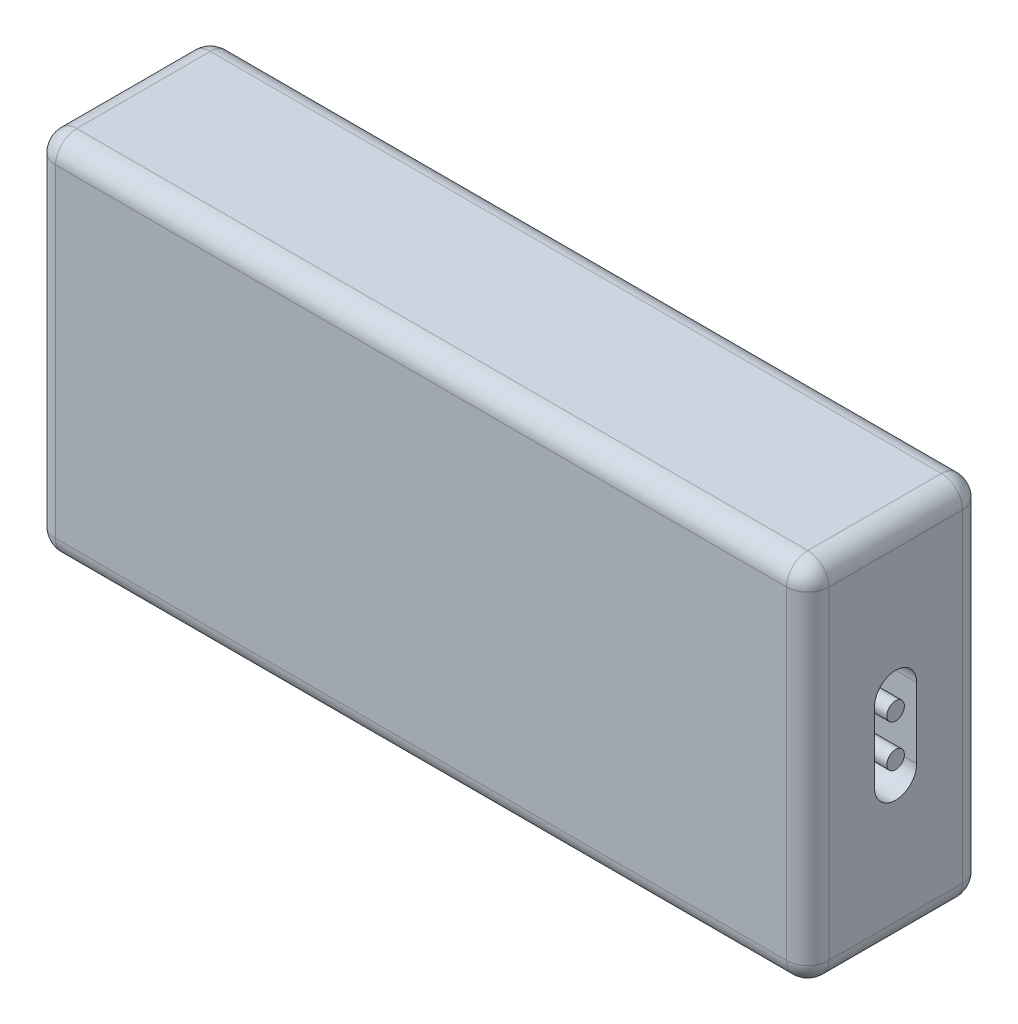
from build123d import *

# Parameters (mm, degrees)
SKETCH_1_W          = 110
SKETCH_1_H          = 52
EXTRUDE_1_DEPTH     = 25
SKETCH_2_R          = 1.25
CUT_EXTRUDE_1_DEPTH = 6
SKETCH_3_W          = 4
SKETCH_3_H          = 10
CUT_EXTRUDE_2_DEPTH = 6
SKETCH_4_W          = 4
SKETCH_4_H          = 10
CUT_EXTRUDE_3_DEPTH = 6
SKETCH_5_W          = 17
SKETCH_5_H          = 8
CUT_EXTRUDE_4_DEPTH = 2
FILLET_1_R          = 3


with BuildPart() as part:
    # Эскиз1 → Бобышка-Вытянуть1 (new body)
    with BuildSketch(Plane.XY):
        with Locations((55, 26)):
            Rectangle(SKETCH_1_W, SKETCH_1_H)
    extrude(amount=EXTRUDE_1_DEPTH)

    # Эскиз2 → Вырез-Вытянуть1 (cut)
    with BuildSketch(Plane(origin=(110, 0, 0), x_dir=(0, 0, -1), z_dir=(1, 0, 0))):
        with BuildLine():
            Line((-9.5, 31), (-9.5, 21))
            ThreePointArc((-9.5, 21), (-12.5, 18), (-15.5, 21))
            Line((-15.5, 21), (-15.5, 31))
            ThreePointArc((-15.5, 31), (-12.5, 34), (-9.5, 31))
        make_face()
        with Locations((-12.5, 29)):
            Circle(SKETCH_2_R, mode=Mode.SUBTRACT)
        with Locations((-12.5, 23)):
            Circle(SKETCH_2_R, mode=Mode.SUBTRACT)
    extrude(amount=-CUT_EXTRUDE_1_DEPTH, mode=Mode.SUBTRACT)

    # Эскиз3 → Вырез-Вытянуть2 (cut)
    with BuildSketch(Plane.ZY):
        with Locations((12.5, 9)):
            Rectangle(SKETCH_3_W, SKETCH_3_H)
    extrude(amount=-CUT_EXTRUDE_2_DEPTH, mode=Mode.SUBTRACT)

    # Эскиз4 → Вырез-Вытянуть3 (cut)
    with BuildSketch(Plane.ZY):
        with Locations((12.5, 43)):
            Rectangle(SKETCH_4_W, SKETCH_4_H)
    extrude(amount=-CUT_EXTRUDE_3_DEPTH, mode=Mode.SUBTRACT)

    # Эскиз5 → Вырез-Вытянуть4 (cut)
    with BuildSketch(Plane(origin=(0, 0, 0), x_dir=(-1, 0, 0), z_dir=(0, 0, -1))):
        with Locations((-23.5, 9)):
            Rectangle(SKETCH_5_W, SKETCH_5_H)
    extrude(amount=-CUT_EXTRUDE_4_DEPTH, mode=Mode.SUBTRACT)

    # Скругление1
    fillet_1_edges = [part.edges().sort_by_distance(p)[0] for p in [
        (0, 0, 12.5),
        (0, 52, 12.5),
        (0, 26, 25),
        (55, 0, 25),
        (110, 0, 12.5),
        (110, 26, 25),
        (110, 52, 12.5),
        (55, 52, 25),
        (0, 26, 0),
        (55, 0, 0),
        (110, 26, 0),
        (55, 52, 0),
    ]]
    fillet(fillet_1_edges, radius=FILLET_1_R)


solid = part.part
